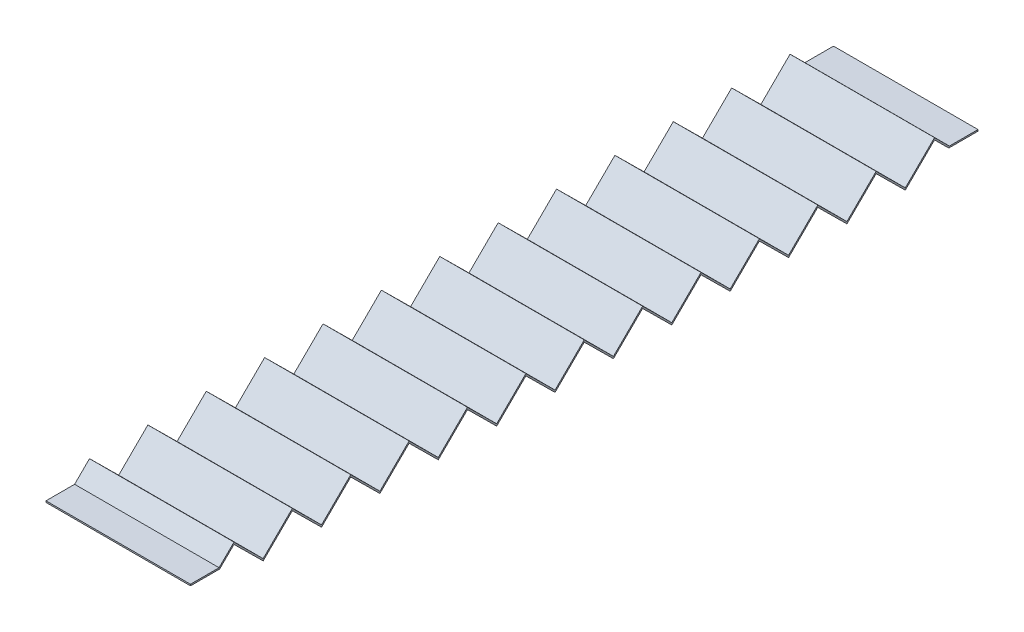
from build123d import *

# Parameters (mm, degrees)
EXTRUDE_THIN1_DEPTH = 25


with BuildPart() as part:
    # Sketch3 → Extrude-Thin1 (new, symmetric)
    with BuildSketch(Plane(origin=(0, 0, 0), x_dir=(0, 0, -1), z_dir=(1, 0, 0))):
        Polygon((0, 4.75), (10.10281687, 4.75), (15.050600294, 9.648213218), (25.151800882, -0.351786782), (35.25300147, 9.648213218), (45.354202058, -0.351786782), (55.455402646, 9.648213218), (65.556603234, -0.351786782), (75.657803822, 9.648213218), (85.75900441, -0.351786782), (95.860204998, 9.648213218), (105.961405586, -0.351786782), (116.062606174, 9.648213218), (126.163806762, -0.351786782), (136.26500735, 9.648213218), (146.366207938, -0.351786782), (156.467408526, 9.648213218), (166.568609114, -0.351786782), (176.669809702, 9.648213218), (186.77101029, -0.351786782), (196.872210878, 9.648213218), (206.973411466, -0.351786782), (217.074612054, 9.648213218), (227.175812642, -0.351786782), (237.27701323, 9.648213218), (247.378213818, -0.351786782), (257.479414406, 9.648213218), (262.42719783, 4.75), (272.5300147, 4.75), (272.5300147, 5.25), (262.63283157, 5.25), (257.479414406, 10.351786782), (247.378213818, 0.351786782), (237.27701323, 10.351786782), (227.175812642, 0.351786782), (217.074612054, 10.351786782), (206.973411466, 0.351786782), (196.872210878, 10.351786782), (186.77101029, 0.351786782), (176.669809702, 10.351786782), (166.568609114, 0.351786782), (156.467408526, 10.351786782), (146.366207938, 0.351786782), (136.26500735, 10.351786782), (126.163806762, 0.351786782), (116.062606174, 10.351786782), (105.961405586, 0.351786782), (95.860204998, 10.351786782), (85.75900441, 0.351786782), (75.657803822, 10.351786782), (65.556603234, 0.351786782), (55.455402646, 10.351786782), (45.354202058, 0.351786782), (35.25300147, 10.351786782), (25.151800882, 0.351786782), (15.050600294, 10.351786782), (9.89718313, 5.25), (0, 5.25), align=None)
    extrude(amount=EXTRUDE_THIN1_DEPTH, both=True)


solid = part.part
